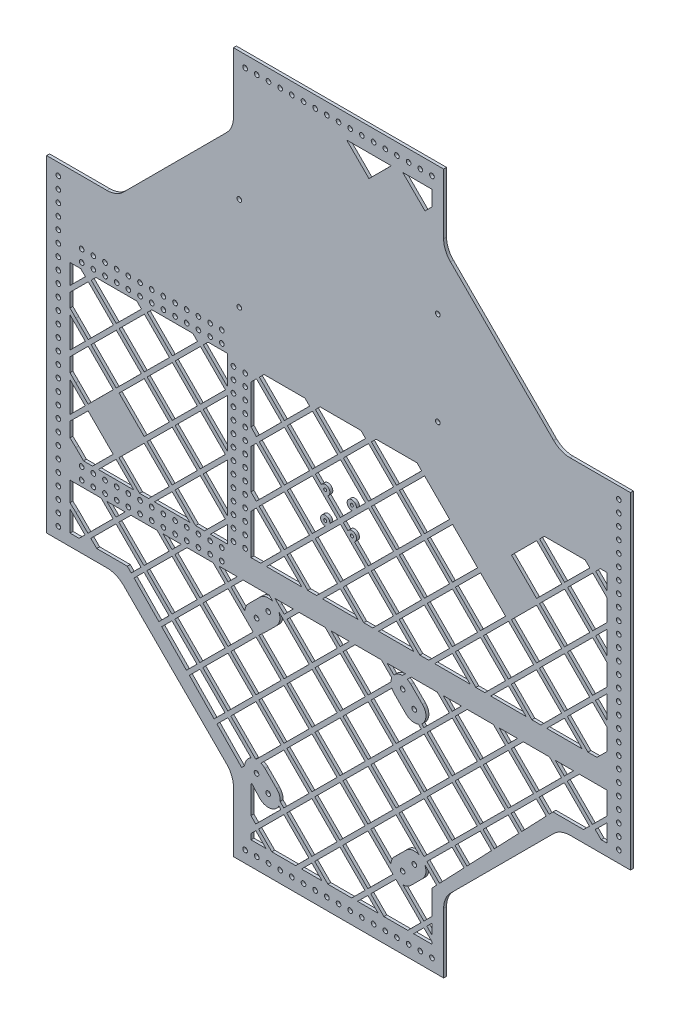
from build123d import *

# Parameters (mm, degrees)
BOSS_EXTRUDE1_DEPTH = 3.175
SKETCH2_R           = 2.54
CUT_EXTRUDE2_DEPTH  = 3.175
SKETCH3_R           = 1.651
SKETCH3_R_2         = 2.54
CUT_EXTRUDE3_DEPTH  = 3.175
SKETCH4_R           = 2.54
CUT_EXTRUDE5_DEPTH  = 3.175
SKETCH5_R           = 2.54
CUT_EXTRUDE7_DEPTH  = 3.175
FILLET1_R           = 25.4
FILLET2_R           = 25.4
FILLET3_R           = 25.4
FILLET4_R           = 25.4
FILLET5_R           = 25.4
CUT_EXTRUDE8_DEPTH  = 3.175


with BuildPart() as part:
    # Sketch1 → Boss-Extrude1 (new body)
    with BuildSketch(Plane.XY):
        Polygon((-241.3, 177.8), (-317.5, 177.8), (-317.5, -177.8), (-241.3, -177.8), (-114.3, -304.8), (-114.3, -381), (114.3, -381), (114.3, -304.8), (241.3, -177.8), (317.5, -177.8), (317.5, 177.8), (241.3, 177.8), (114.3, 304.8), (114.3, 381), (-114.3, 381), (-114.3, 304.8), align=None)
    extrude(amount=BOSS_EXTRUDE1_DEPTH)

    # Sketch2 → Cut-Extrude2 (cut)
    with BuildSketch(Plane.XY.offset(3.175)):
        with Locations((-304.8, 165.1)):
            Circle(SKETCH2_R)
        with Locations((-304.8, 152.4)):
            Circle(SKETCH2_R)
        with Locations((-304.8, 139.7)):
            Circle(SKETCH2_R)
        with Locations((-304.8, 127)):
            Circle(SKETCH2_R)
        with Locations((-304.8, 114.3)):
            Circle(SKETCH2_R)
        with Locations((-304.8, 101.6)):
            Circle(SKETCH2_R)
        with Locations((-304.8, 88.9)):
            Circle(SKETCH2_R)
        with Locations((-304.8, 76.2)):
            Circle(SKETCH2_R)
        with Locations((-304.8, 63.5)):
            Circle(SKETCH2_R)
        with Locations((-304.8, 50.8)):
            Circle(SKETCH2_R)
        with Locations((-304.8, 38.1)):
            Circle(SKETCH2_R)
        with Locations((-304.8, 25.4)):
            Circle(SKETCH2_R)
        with Locations((-304.8, 12.7)):
            Circle(SKETCH2_R)
        with Locations((-304.8, 0)):
            Circle(SKETCH2_R)
        with Locations((-304.8, -12.7)):
            Circle(SKETCH2_R)
        with Locations((-304.8, -25.4)):
            Circle(SKETCH2_R)
        with Locations((-304.8, -38.1)):
            Circle(SKETCH2_R)
        with Locations((-304.8, -50.8)):
            Circle(SKETCH2_R)
        with Locations((-304.8, -63.5)):
            Circle(SKETCH2_R)
        with Locations((-304.8, -76.2)):
            Circle(SKETCH2_R)
        with Locations((-304.8, -88.9)):
            Circle(SKETCH2_R)
        with Locations((-304.8, -101.6)):
            Circle(SKETCH2_R)
        with Locations((-304.8, -114.3)):
            Circle(SKETCH2_R)
        with Locations((-304.8, -127)):
            Circle(SKETCH2_R)
        with Locations((-304.8, -139.7)):
            Circle(SKETCH2_R)
        with Locations((-304.8, -152.4)):
            Circle(SKETCH2_R)
        with Locations((-304.8, -165.1)):
            Circle(SKETCH2_R)
        with Locations((304.8, -165.1)):
            Circle(SKETCH2_R)
        with Locations((304.8, -152.4)):
            Circle(SKETCH2_R)
        with Locations((304.8, -139.7)):
            Circle(SKETCH2_R)
        with Locations((304.8, -127)):
            Circle(SKETCH2_R)
        with Locations((304.8, -114.3)):
            Circle(SKETCH2_R)
        with Locations((304.8, -101.6)):
            Circle(SKETCH2_R)
        with Locations((304.8, -88.9)):
            Circle(SKETCH2_R)
        with Locations((304.8, -76.2)):
            Circle(SKETCH2_R)
        with Locations((304.8, -63.5)):
            Circle(SKETCH2_R)
        with Locations((304.8, -50.8)):
            Circle(SKETCH2_R)
        with Locations((304.8, -38.1)):
            Circle(SKETCH2_R)
        with Locations((304.8, -25.4)):
            Circle(SKETCH2_R)
        with Locations((304.8, -12.7)):
            Circle(SKETCH2_R)
        with Locations((304.8, 0)):
            Circle(SKETCH2_R)
        with Locations((304.8, 12.7)):
            Circle(SKETCH2_R)
        with Locations((304.8, 25.4)):
            Circle(SKETCH2_R)
        with Locations((304.8, 38.1)):
            Circle(SKETCH2_R)
        with Locations((304.8, 50.8)):
            Circle(SKETCH2_R)
        with Locations((304.8, 63.5)):
            Circle(SKETCH2_R)
        with Locations((304.8, 76.2)):
            Circle(SKETCH2_R)
        with Locations((304.8, 88.9)):
            Circle(SKETCH2_R)
        with Locations((304.8, 101.6)):
            Circle(SKETCH2_R)
        with Locations((304.8, 114.3)):
            Circle(SKETCH2_R)
        with Locations((304.8, 127)):
            Circle(SKETCH2_R)
        with Locations((304.8, 139.7)):
            Circle(SKETCH2_R)
        with Locations((304.8, 152.4)):
            Circle(SKETCH2_R)
        with Locations((304.8, 165.1)):
            Circle(SKETCH2_R)
        with Locations((-101.6, -368.3)):
            Circle(SKETCH2_R)
        with Locations((-88.9, -368.3)):
            Circle(SKETCH2_R)
        with Locations((-76.2, -368.3)):
            Circle(SKETCH2_R)
        with Locations((-63.5, -368.3)):
            Circle(SKETCH2_R)
        with Locations((-50.8, -368.3)):
            Circle(SKETCH2_R)
        with Locations((-38.1, -368.3)):
            Circle(SKETCH2_R)
        with Locations((-25.4, -368.3)):
            Circle(SKETCH2_R)
        with Locations((-12.7, -368.3)):
            Circle(SKETCH2_R)
        with Locations((0, -368.3)):
            Circle(SKETCH2_R)
        with Locations((12.7, -368.3)):
            Circle(SKETCH2_R)
        with Locations((25.4, -368.3)):
            Circle(SKETCH2_R)
        with Locations((38.1, -368.3)):
            Circle(SKETCH2_R)
        with Locations((50.8, -368.3)):
            Circle(SKETCH2_R)
        with Locations((63.5, -368.3)):
            Circle(SKETCH2_R)
        with Locations((76.2, -368.3)):
            Circle(SKETCH2_R)
        with Locations((88.9, -368.3)):
            Circle(SKETCH2_R)
        with Locations((101.6, -368.3)):
            Circle(SKETCH2_R)
        with Locations((101.6, 368.3)):
            Circle(SKETCH2_R)
        with Locations((88.9, 368.3)):
            Circle(SKETCH2_R)
        with Locations((76.2, 368.3)):
            Circle(SKETCH2_R)
        with Locations((63.5, 368.3)):
            Circle(SKETCH2_R)
        with Locations((50.8, 368.3)):
            Circle(SKETCH2_R)
        with Locations((38.1, 368.3)):
            Circle(SKETCH2_R)
        with Locations((25.4, 368.3)):
            Circle(SKETCH2_R)
        with Locations((12.7, 368.3)):
            Circle(SKETCH2_R)
        with Locations((0, 368.3)):
            Circle(SKETCH2_R)
        with Locations((-12.7, 368.3)):
            Circle(SKETCH2_R)
        with Locations((-25.4, 368.3)):
            Circle(SKETCH2_R)
        with Locations((-38.1, 368.3)):
            Circle(SKETCH2_R)
        with Locations((-50.8, 368.3)):
            Circle(SKETCH2_R)
        with Locations((-63.5, 368.3)):
            Circle(SKETCH2_R)
        with Locations((-76.2, 368.3)):
            Circle(SKETCH2_R)
        with Locations((-88.9, 368.3)):
            Circle(SKETCH2_R)
        with Locations((-101.6, 368.3)):
            Circle(SKETCH2_R)
    extrude(amount=-CUT_EXTRUDE2_DEPTH, mode=Mode.SUBTRACT)

    # Sketch3 → Cut-Extrude3 (cut)
    with BuildSketch(Plane.XY.offset(3.175)):
        with Locations((-14.478, 14.478)):
            Circle(SKETCH3_R)
        with Locations((14.478, 14.478)):
            Circle(SKETCH3_R)
        with Locations((-14.478, -14.478)):
            Circle(SKETCH3_R)
        with Locations((14.478, -14.478)):
            Circle(SKETCH3_R)
        with Locations((-107.95, 241.3)):
            Circle(SKETCH3_R_2)
        with Locations((107.95, 241.3)):
            Circle(SKETCH3_R_2)
        with Locations((-107.95, 139.7)):
            Circle(SKETCH3_R_2)
        with Locations((107.95, 139.7)):
            Circle(SKETCH3_R_2)
    extrude(amount=-CUT_EXTRUDE3_DEPTH, mode=Mode.SUBTRACT)

    # Sketch4 → Cut-Extrude5 (cut)
    with BuildSketch(Plane.XY.offset(3.175)):
        with Locations((-114.3, -84.201)):
            Circle(SKETCH4_R)
        with Locations((-114.3, 80.899)):
            Circle(SKETCH4_R)
        with Locations((-279.4, 96.139)):
            Circle(SKETCH4_R)
        with Locations((-266.7, 96.139)):
            Circle(SKETCH4_R)
        with Locations((-254, 96.139)):
            Circle(SKETCH4_R)
        with Locations((-241.3, 96.139)):
            Circle(SKETCH4_R)
        with Locations((-228.6, 96.139)):
            Circle(SKETCH4_R)
        with Locations((-215.9, 96.139)):
            Circle(SKETCH4_R)
        with Locations((-203.2, 96.139)):
            Circle(SKETCH4_R)
        with Locations((-190.5, 96.139)):
            Circle(SKETCH4_R)
        with Locations((-177.8, 96.139)):
            Circle(SKETCH4_R)
        with Locations((-165.1, 96.139)):
            Circle(SKETCH4_R)
        with Locations((-152.4, 96.139)):
            Circle(SKETCH4_R)
        with Locations((-139.7, 96.139)):
            Circle(SKETCH4_R)
        with Locations((-127, 96.139)):
            Circle(SKETCH4_R)
        with Locations((-127, -96.139)):
            Circle(SKETCH4_R)
        with Locations((-139.7, -96.139)):
            Circle(SKETCH4_R)
        with Locations((-152.4, -96.139)):
            Circle(SKETCH4_R)
        with Locations((-165.1, -96.139)):
            Circle(SKETCH4_R)
        with Locations((-177.8, -96.139)):
            Circle(SKETCH4_R)
        with Locations((-190.5, -96.139)):
            Circle(SKETCH4_R)
        with Locations((-203.2, -96.139)):
            Circle(SKETCH4_R)
        with Locations((-215.9, -96.139)):
            Circle(SKETCH4_R)
        with Locations((-228.6, -96.139)):
            Circle(SKETCH4_R)
        with Locations((-241.3, -96.139)):
            Circle(SKETCH4_R)
        with Locations((-254, -96.139)):
            Circle(SKETCH4_R)
        with Locations((-266.7, -96.139)):
            Circle(SKETCH4_R)
        with Locations((-279.4, -96.139)):
            Circle(SKETCH4_R)
        with Locations((-279.4, -108.839)):
            Circle(SKETCH4_R)
        with Locations((-279.4, 108.839)):
            Circle(SKETCH4_R)
        with Locations((-266.7, 108.839)):
            Circle(SKETCH4_R)
        with Locations((-254, 108.839)):
            Circle(SKETCH4_R)
        with Locations((-241.3, 108.839)):
            Circle(SKETCH4_R)
        with Locations((-228.6, 108.839)):
            Circle(SKETCH4_R)
        with Locations((-215.9, 108.839)):
            Circle(SKETCH4_R)
        with Locations((-203.2, 108.839)):
            Circle(SKETCH4_R)
        with Locations((-190.5, 108.839)):
            Circle(SKETCH4_R)
        with Locations((-177.8, 108.839)):
            Circle(SKETCH4_R)
        with Locations((-165.1, 108.839)):
            Circle(SKETCH4_R)
        with Locations((-152.4, 108.839)):
            Circle(SKETCH4_R)
        with Locations((-139.7, 108.839)):
            Circle(SKETCH4_R)
        with Locations((-127, 108.839)):
            Circle(SKETCH4_R)
        with Locations((-127, -108.839)):
            Circle(SKETCH4_R)
        with Locations((-139.7, -108.839)):
            Circle(SKETCH4_R)
        with Locations((-152.4, -108.839)):
            Circle(SKETCH4_R)
        with Locations((-165.1, -108.839)):
            Circle(SKETCH4_R)
        with Locations((-177.8, -108.839)):
            Circle(SKETCH4_R)
        with Locations((-190.5, -108.839)):
            Circle(SKETCH4_R)
        with Locations((-203.2, -108.839)):
            Circle(SKETCH4_R)
        with Locations((-215.9, -108.839)):
            Circle(SKETCH4_R)
        with Locations((-228.6, -108.839)):
            Circle(SKETCH4_R)
        with Locations((-241.3, -108.839)):
            Circle(SKETCH4_R)
        with Locations((-254, -108.839)):
            Circle(SKETCH4_R)
        with Locations((-266.7, -108.839)):
            Circle(SKETCH4_R)
        with Locations((-114.3, 68.199)):
            Circle(SKETCH4_R)
        with Locations((-101.6, -84.201)):
            Circle(SKETCH4_R)
        with Locations((-101.6, -71.501)):
            Circle(SKETCH4_R)
        with Locations((-101.6, -58.801)):
            Circle(SKETCH4_R)
        with Locations((-101.6, -46.101)):
            Circle(SKETCH4_R)
        with Locations((-101.6, -33.401)):
            Circle(SKETCH4_R)
        with Locations((-101.6, -20.701)):
            Circle(SKETCH4_R)
        with Locations((-101.6, -8.001)):
            Circle(SKETCH4_R)
        with Locations((-101.6, 4.699)):
            Circle(SKETCH4_R)
        with Locations((-101.6, 17.399)):
            Circle(SKETCH4_R)
        with Locations((-101.6, 30.099)):
            Circle(SKETCH4_R)
        with Locations((-101.6, 42.799)):
            Circle(SKETCH4_R)
        with Locations((-101.6, 55.499)):
            Circle(SKETCH4_R)
        with Locations((-101.6, 68.199)):
            Circle(SKETCH4_R)
        with Locations((-101.6, 80.899)):
            Circle(SKETCH4_R)
        with Locations((-114.3, 55.499)):
            Circle(SKETCH4_R)
        with Locations((-114.3, 42.799)):
            Circle(SKETCH4_R)
        with Locations((-114.3, 30.099)):
            Circle(SKETCH4_R)
        with Locations((-114.3, 17.399)):
            Circle(SKETCH4_R)
        with Locations((-114.3, 4.699)):
            Circle(SKETCH4_R)
        with Locations((-114.3, -8.001)):
            Circle(SKETCH4_R)
        with Locations((-114.3, -20.701)):
            Circle(SKETCH4_R)
        with Locations((-114.3, -33.401)):
            Circle(SKETCH4_R)
        with Locations((-114.3, -46.101)):
            Circle(SKETCH4_R)
        with Locations((-114.3, -58.801)):
            Circle(SKETCH4_R)
        with Locations((-114.3, -71.501)):
            Circle(SKETCH4_R)
    extrude(amount=-CUT_EXTRUDE5_DEPTH, mode=Mode.SUBTRACT)

    # Sketch5 → Cut-Extrude7 (cut)
    with BuildSketch(Plane.XY.offset(3.175)):
        with Locations((-76.492754683, -131.119022234)):
            Circle(SKETCH5_R)
        with Locations((-89.192754683, -143.819022234)):
            Circle(SKETCH5_R)
        with Locations((69.658845317, -131.119022234)):
            Circle(SKETCH5_R)
        with Locations((82.358845317, -143.819022234)):
            Circle(SKETCH5_R)
        with Locations((82.358845317, -289.970622234)):
            Circle(SKETCH5_R)
        with Locations((69.658845317, -302.670622234)):
            Circle(SKETCH5_R)
        with Locations((-76.492754683, -302.670622234)):
            Circle(SKETCH5_R)
        with Locations((-89.192754683, -289.970622234)):
            Circle(SKETCH5_R)
    extrude(amount=-CUT_EXTRUDE7_DEPTH, mode=Mode.SUBTRACT)

    # Fillet1
    fillet1_edges = [part.edges().sort_by_distance(p)[0] for p in [
        (-241.3, -177.8, 1.5875),
    ]]
    fillet(fillet1_edges, radius=FILLET1_R)

    # Fillet2
    fillet2_edges = [part.edges().sort_by_distance(p)[0] for p in [
        (-114.3, -304.8, 1.5875),
    ]]
    fillet(fillet2_edges, radius=FILLET2_R)

    # Fillet3
    fillet3_edges = [part.edges().sort_by_distance(p)[0] for p in [
        (114.3, -304.8, 1.5875),
        (241.3, -177.8, 1.5875),
    ]]
    fillet(fillet3_edges, radius=FILLET3_R)

    # Fillet4
    fillet4_edges = [part.edges().sort_by_distance(p)[0] for p in [
        (114.3, 304.8, 1.5875),
        (241.3, 177.8, 1.5875),
    ]]
    fillet(fillet4_edges, radius=FILLET4_R)

    # Fillet5
    fillet5_edges = [part.edges().sort_by_distance(p)[0] for p in [
        (-241.3, 177.8, 1.5875),
        (-114.3, 304.8, 1.5875),
    ]]
    fillet(fillet5_edges, radius=FILLET5_R)

    # Sketch7 → Cut-Extrude8 (cut)
    with BuildSketch(Plane.XY.offset(3.175)):
        with BuildLine():
            Line((-98.184821722, -134.845737084), (-85.494687088, -122.129040862))
            ThreePointArc((-85.494687088, -122.129040862), (-78.628005541, -118.574432494), (-70.971329287, -119.652330847))
            Line((-70.971329287, -119.652330847), (-75.433951777, -115.189))
            Line((-75.433951777, -115.189), (-103.85276116, -115.189))
            Line((-103.85276116, -115.189), (-116.971631728, -128.263395034))
            Line((-116.971631728, -128.263395034), (-101.887519046, -143.349902012))
            ThreePointArc((-101.887519046, -143.349902012), (-100.840066362, -138.74780476), (-98.184821722, -134.845737084))
        make_face()
        with BuildLine():
            Line((-67.502773296, -140.120954724), (-80.219469568, -152.811089309))
            ThreePointArc((-80.219469568, -152.811089309), (-81.258690332, -153.740097726), (-82.393439983, -154.549652954))
            Line((-82.393439983, -154.549652954), (-84.284463929, -156.440376783))
            Line((-84.284463929, -156.440376783), (-86.545804888, -158.694051356))
            Line((-86.545804888, -158.694051356), (-59.289334923, -185.954847732))
            Line((-59.289334923, -185.954847732), (-31.935804859, -158.694051424))
            Line((-31.935804859, -158.694051424), (-57.56647343, -133.05931447))
            Line((-57.56647343, -133.05931447), (-65.025187583, -125.599416388))
            ThreePointArc((-65.025187583, -125.599416388), (-63.948334661, -133.255268416), (-67.502773296, -140.120954724))
        make_face()
        with BuildLine():
            Line((60.280451027, -294.0920176), (72.643928389, -281.827084389))
            ThreePointArc((72.643928389, -281.827084389), (79.73308493, -277.56892066), (87.939692092, -278.588576336))
            Line((87.939692092, -278.588576336), (62.511032708, -253.155880635))
            Line((62.511032708, -253.155880635), (35.157502709, -280.416676879))
            Line((35.157502709, -280.416676879), (56.925364075, -302.18799345))
            ThreePointArc((56.925364075, -302.18799345), (57.88280902, -297.841586504), (60.280451027, -294.0920176))
        make_face()
        with BuildLine():
            Line((91.249518726, -299.006813129), (78.353512395, -311.934871675))
            ThreePointArc((78.353512395, -311.934871675), (74.559126798, -314.412673024), (70.136500565, -315.401226906))
            Line((70.136500565, -315.401226906), (92.839799146, -338.108129491))
            Line((92.839799146, -338.108129491), (101.599999978, -329.377627211))
            Line((101.599999978, -329.377627211), (101.599999978, -302.705897911))
            Line((101.599999978, -302.705897911), (106.710118143, -297.361981836))
            Line((106.710118143, -297.361981836), (93.741776855, -284.39158207))
            ThreePointArc((93.741776855, -284.39158207), (94.855085116, -292.10153998), (91.249518726, -299.006813129))
        make_face()
        with BuildLine():
            ThreePointArc((-84.283511312, -277.949331359), (-82.007220036, -279.154883858), (-80.013678376, -280.786033896))
            Line((-80.013678376, -280.786033896), (-67.309867493, -293.482220725))
            ThreePointArc((-67.309867493, -293.482220725), (-64.31386037, -298.151034561), (-63.538813818, -303.644046863))
            Line((-63.538813818, -303.644046863), (-59.506027488, -307.677473321))
            Line((-59.506027488, -307.677473321), (-32.152497389, -280.416676976))
            Line((-32.152497389, -280.416676976), (-59.408967431, -253.155880488))
            Line((-59.408967431, -253.155880488), (-83.328830746, -276.994650793))
            Line((-83.328830746, -276.994650793), (-84.283511312, -277.949331359))
        make_face()
        with BuildLine():
            Line((-85.782728065, -311.750739744), (-94.284212526, -302.103134487))
            Line((-94.284212526, -302.103134487), (-95.249999849, -302.954187749))
            Line((-95.249999849, -302.954187749), (-95.249999849, -332.897503271))
            Line((-95.249999849, -332.897503271), (-90.040200527, -338.108129611))
            Line((-90.040200527, -338.108129611), (-62.686670523, -310.847333362))
            Line((-62.686670523, -310.847333362), (-64.934171741, -308.599475396))
            ThreePointArc((-64.934171741, -308.599475396), (-74.551295417, -315.515188219), (-85.782728065, -311.750739744))
        make_face()
        Polygon((101.6, 338.909043196), (101.6, 355.599999928), (69.801765259, 355.599999928), (94.031608819, 331.366310339), align=None)
        Polygon((92.948145642, -277.246816941), (120.301675746, -249.986020592), (93.045205846, -222.725224245), (65.691675743, -249.986020594), align=None)
        Polygon((229.017369551, -169.458934272), (233.185599159, -165.1), (266.4364552, -165.1), (272.864195328, -158.694051166), (245.607725452, -131.433254887), (218.254195156, -158.694051428), align=None)
        Polygon((81.638426288, -355.60000025), (101.599999978, -355.60000025), (101.599999978, -353.220728772), (92.828513161, -344.447849649), align=None)
        Polygon((-263.020872944, -165.1), (-229.689487758, -165.1), (-225.526643889, -169.368578147), (-214.815805085, -158.694051194), (-242.07227485, -131.433254983), (-269.42580499, -158.694051294), align=None)
        Polygon((-86.65415113, -219.555364193), (-59.397681355, -246.816160414), (-32.044151227, -219.555364097), (-59.300621029, -192.294567848), align=None)
        with BuildLine():
            ThreePointArc((74.727379067, -119.474282408), (76.808460175, -120.622689189), (78.639101444, -122.138766119))
            Line((78.639101444, -122.138766119), (91.339101436, -134.838766127))
            ThreePointArc((91.339101436, -134.838766127), (95.048045081, -144.342671996), (90.568643955, -153.508666502))
            Line((90.568643955, -153.508666502), (92.870089445, -155.817940878))
            Line((92.870089445, -155.817940878), (120.518368288, -128.263395045))
            Line((120.518368288, -128.263395045), (107.446048225, -115.189))
            Line((107.446048225, -115.189), (79.02723884, -115.189))
            Line((79.02723884, -115.189), (75.784235839, -118.421008587))
            Line((75.784235839, -118.421008587), (74.727379067, -119.474282408))
        make_face()
        Polygon((-258.313951776, -115.189), (-292.100000028, -115.189), (-292.100000028, -136.524575346), (-285.750000002, -142.367265128), (-272.595161951, -155.524191258), (-245.24163181, -128.263394947), align=None)
        with BuildLine():
            Line((73.37858921, -152.799278353), (60.678589202, -140.099278361))
            ThreePointArc((60.678589202, -140.099278361), (59.150387547, -138.25080429), (57.99696019, -136.147981896))
            Line((57.99696019, -136.147981896), (35.374195107, -158.694051387))
            Line((35.374195107, -158.694051387), (62.630665052, -185.954847778))
            Line((62.630665052, -185.954847778), (89.984195141, -158.694051443))
            Line((89.984195141, -158.694051443), (86.950527943, -155.659902707))
            ThreePointArc((86.950527943, -155.659902707), (79.739553958, -156.245981335), (73.37858921, -152.799278353))
        make_face()
        Polygon((-120.65, 58.324585843), (-120.65, 89.789000011), (-142.017481788, 89.789000011), (-147.072419558, 84.751199466), align=None)
        Polygon((-89.293062601, 81.581339414), (-95.250000009, 75.64459719), (-95.250000009, 33.438695612), (-89.338546527, 27.111148313), (-62.036592749, 54.320543116), align=None)
        Polygon((-95.249999755, -355.60000025), (-78.901106158, -355.60000025), (-90.051486631, -344.447849733), (-95.249999755, -349.628738892), align=None)
        Polygon((169.415866311, -231.787322949), (196.112372979, -203.869398845), (184.539378983, -192.294567857), (157.185848866, -219.55536422), align=None)
        Polygon((-95.250000009, -27.896529968), (-89.471550028, -33.77473783), (-62.14493914, -6.540769531), (-89.427628342, 20.746250283), (-95.250000009, 15.038671504), align=None)
        Polygon((139.615114716, -262.951517262), (166.311621352, -235.033593192), (154.005205831, -222.72522426), (126.651675745, -249.986020592), align=None)
        Polygon((292.1, -78.770125863), (292.1, -55.993557114), (276.250244659, -40.141285925), (248.897059238, -67.401738761), (271.280851834, -89.788999974), (281.043642701, -89.788999974), align=None)
        Polygon((-11.591106142, -355.60000025), (14.328426288, -355.60000025), (28.699156341, -341.277989749), (1.442686442, -314.017193403), (-25.910843658, -341.277989748), align=None)
        Polygon((-72.551106158, -355.60000025), (-46.631573711, -355.60000025), (-32.260843658, -341.277989748), (-59.517313555, -314.017193405), (-86.870843577, -341.277989674), align=None)
        Polygon((292.1, 42.736541774), (292.1, 65.949607141), (276.468846375, 81.583241915), (249.113407278, 54.320543101), (276.369876999, 27.059746931), align=None)
        Polygon((20.678426288, -355.60000025), (43.018893856, -355.60000025), (31.868513306, -344.447849789), align=None)
        Polygon((49.368893855, -355.60000025), (75.288426288, -355.60000025), (89.659156156, -341.277989568), (62.402686439, -314.017193405), (35.049156341, -341.277989749), align=None)
        Polygon((-292.100000028, -20.427912614), (-292.100000028, -53.456236922), (-275.55911223, -36.971425964), align=None)
        Polygon((-292.100000028, 89.789), (-292.100000028, 68.05043048), (-275.342419563, 84.751199464), (-280.379420571, 89.789), align=None)
        Polygon((-292.100000028, 40.541763629), (-292.100000028, 7.283376379), (-275.443894595, 23.883014356), align=None)
        Polygon((-275.77580499, -158.694051294), (-292.100000028, -142.367265102), (-292.100000028, -165.1), (-282.203544995, -165.1), align=None)
        Polygon((-216.399920675, -89.788999974), (-206.636357388, -89.788999974), (-184.173285456, -67.402082259), (-211.429755292, -40.141285975), (-238.783285428, -67.402082287), align=None)
        Polygon((-261.246357326, -89.788999974), (-222.749920675, -89.788999974), (-241.963928467, -70.571942324), align=None)
        Polygon((-155.439920675, -89.788999974), (-145.67635753, -89.788999974), (-123.213285518, -67.402082196), (-150.469755317, -40.141285949), (-177.823285456, -67.402082259), align=None)
        Polygon((-200.286357388, -89.788999974), (-161.789920675, -89.788999974), (-181.003928495, -70.571942295), align=None)
        Polygon((-95.250000009, -89.788999974), (-84.716357245, -89.788999974), (-62.253285391, -67.402082321), (-89.467154955, -40.183893072), (-95.250000009, -46.103888993), align=None)
        Polygon((-33.519920673, -89.788999974), (-23.756357298, -89.788999974), (-1.293285427, -67.402082296), (-28.549755266, -40.141286007), (-55.903285391, -67.402082321), align=None)
        Polygon((-78.366357246, -89.788999974), (-39.869920673, -89.788999974), (-59.08392843, -70.571942358), align=None)
        Polygon((27.440079314, -89.788999974), (37.203642687, -89.788999974), (59.666714551, -67.402082267), (32.410244699, -40.141285969), (5.056714573, -67.402082296), align=None)
        Polygon((-17.406357299, -89.788999974), (21.090079314, -89.788999974), (1.876071535, -70.571942334), align=None)
        Polygon((88.400079325, -89.788999974), (98.163642754, -89.788999974), (120.626714613, -67.402082316), (93.370244659, -40.141285915), (66.016714551, -67.402082267), align=None)
        Polygon((43.553642687, -89.788999974), (82.050079325, -89.788999974), (62.836071516, -70.571942307), align=None)
        Polygon((149.360079336, -89.788999974), (159.123642702, -89.788999974), (181.586714707, -67.402082123), (154.330244866, -40.141285875), (126.976714613, -67.402082316), align=None)
        Polygon((104.513642754, -89.788999974), (143.010079336, -89.788999974), (123.796071575, -70.571942353), align=None)
        Polygon((210.320079657, -89.788999974), (220.083642702, -89.788999974), (242.547059238, -67.401738761), (215.290537876, -40.140993701), (187.936714707, -67.402082123), align=None)
        Polygon((199.216617939, -200.623128603), (225.913124591, -172.705204515), (215.073552121, -161.863911468), (187.720022018, -189.124707817), align=None)
        Polygon((165.473642701, -89.788999974), (203.970079657, -89.788999974), (184.756071675, -70.571942161), align=None)
        Polygon((226.433642701, -89.788999974), (264.930851834, -89.788999974), (245.716422187, -70.571592838), align=None)
        Polygon((-150.458469238, -33.801565878), (-123.104939099, -6.540769569), (-150.361408944, 20.720026723), (-177.714939079, -6.54076959), align=None)
        Polygon((109.814363103, -294.115711594), (136.510869757, -266.197787505), (123.471032711, -253.155880632), (96.117502607, -280.416676981), align=None)
        Polygon((292.1, -18.016792047), (292.1, 4.976119129), (276.35859093, 20.72002685), (249.005060829, -6.540769497), (276.261530729, -33.801565845), align=None)
        Polygon((-150.350122863, 27.059746797), (-122.996592728, 54.320543109), (-150.253062597, 81.581339429), (-177.606592725, 54.32054311), align=None)
        Polygon((-40.281573712, -355.60000025), (-17.941106142, -355.60000025), (-29.091486693, -344.447849788), align=None)
        with BuildLine():
            ThreePointArc((-90.157218448, -277.021417068), (-89.918148063, -277.00582724), (-89.678830745, -276.994650793))
            Line((-89.678830745, -276.994650793), (-62.578324393, -249.986020451))
            Line((-62.578324393, -249.986020451), (-89.834794165, -222.725224233))
            Line((-89.834794165, -222.725224233), (-117.188324265, -249.986020577))
            Line((-117.188324265, -249.986020577), (-90.157218448, -277.021417068))
        make_face()
        with BuildLine():
            ThreePointArc((-102.167000616, -289.440483327), (-100.131563165, -282.973867716), (-95.114435966, -278.414420628))
            Line((-95.114435966, -278.414420628), (-120.3689673, -253.155880617))
            Line((-120.3689673, -253.155880617), (-132.258788612, -265.005393136))
            Line((-132.258788612, -265.005393136), (-105.342562093, -292.605279164))
            Line((-105.342562093, -292.605279164), (-102.167000616, -289.440483327))
        make_face()
        Polygon((-162.304809134, -234.196217806), (-135.388582405, -261.796104051), (-123.538324265, -249.986020577), (-150.794794265, -222.725224131), align=None)
        Polygon((-192.350829518, -203.387042619), (-165.434602925, -230.986928724), (-153.964151227, -219.555364094), (-181.220621097, -192.294567778), align=None)
        Polygon((-222.396850102, -172.577867227), (-195.480623308, -200.177753537), (-184.389978059, -189.124707741), (-211.646448125, -161.863911229), align=None)
        Polygon((-277.359920675, -89.788999974), (-267.596357326, -89.788999974), (-245.133285428, -67.402082287), (-272.389755268, -40.141286001), (-285.749999994, -53.456236887), (-292.100000028, -59.518217807), (-292.100000028, -75.505421203), (-285.750000028, -81.397588858), align=None)
        with BuildLine():
            ThreePointArc((-14.240895343, -19.552463655), (-18.063997976, -10.879803435), (-9.4043708, -14.732335874))
            Line((-9.4043708, -14.732335874), (-1.18493906, -6.540769614))
            Line((-1.18493906, -6.540769614), (-28.441408994, 20.720026765))
            Line((-28.441408994, 20.720026765), (-55.79493914, -6.540769531))
            Line((-55.79493914, -6.540769531), (-28.538469189, -33.801565932))
            Line((-28.538469189, -33.801565932), (-14.240895343, -19.552463655))
        make_face()
        with BuildLine():
            ThreePointArc((14.81958641, 9.409497388), (10.892002024, 18.076196565), (19.545313378, 14.119203219))
            Line((19.545313378, 14.119203219), (29.349234115, 23.88988675))
            Line((29.349234115, 23.88988675), (2.092764205, 51.150683107))
            Line((2.092764205, 51.150683107), (-25.260765953, 23.8898868))
            Line((-25.260765953, 23.8898868), (-18.689958436, 17.318036292))
            ThreePointArc((-18.689958436, 17.318036292), (-10.885612496, 18.069817372), (-11.638632259, 10.265590851))
            Line((-11.638632259, 10.265590851), (1.995703978, -3.370909577))
            Line((1.995703978, -3.370909577), (14.81958641, 9.409497388))
        make_face()
        with BuildLine():
            ThreePointArc((56.961667651, -130.851292333), (57.201134254, -128.650128742), (57.8192573, -126.524008024))
            Line((57.8192573, -126.524008024), (46.486048209, -115.189))
            Line((46.486048209, -115.189), (18.067238824, -115.189))
            Line((18.067238824, -115.189), (4.948368279, -128.263395036))
            Line((4.948368279, -128.263395036), (32.204838145, -155.52419135))
            Line((32.204838145, -155.52419135), (56.961667651, -130.851292333))
        make_face()
        with BuildLine():
            ThreePointArc((60.242744495, -122.596871959), (64.405724102, -119.556379046), (69.434235839, -118.421008587))
            Line((69.434235839, -118.421008587), (72.67723884, -115.189))
            Line((72.67723884, -115.189), (52.836048209, -115.189))
            Line((52.836048209, -115.189), (60.242744495, -122.596871959))
        make_face()
        Polygon((1.984417902, -9.710629651), (-25.369112228, -36.971425969), (1.887357611, -64.232222258), (29.240887737, -36.971425932), align=None)
        Polygon((174.756048234, -115.189), (184.659011327, -125.093535001), (194.59723884, -115.189), align=None)
        Polygon((35.26584888, -219.555364209), (62.522318778, -246.816160554), (89.875848881, -219.555364205), (62.619378983, -192.294567859), align=None)
        Polygon((-58.975582181, -9.710629566), (-86.329112328, -36.971425862), (-59.072642353, -64.232222284), (-31.719112228, -36.971425969), align=None)
        Polygon((279.430887694, -36.971425885), (292.1, -49.642549172), (292.1, -24.345264319), align=None)
        Polygon((279.649489413, 84.753101952), (292.101905884, 72.298708896), (292.1, 89.789), (284.702518216, 89.789), align=None)
        Polygon((-272.173062603, 81.581339428), (-292.100000028, 61.721958224), (-292.100000028, 46.891763629), (-285.750000006, 40.541763607), (-272.263251556, 27.052874392), (-244.909721421, 54.313670708), align=None)
        Polygon((-272.274537634, 20.713154319), (-292.100000028, 0.954904121), (-292.100000028, -14.077912614), (-285.750000002, -20.427912641), (-272.378469192, -33.801565927), (-245.024939063, -6.540769607), align=None)
        Polygon((-120.65, -71.175958971), (-139.32635753, -89.788999974), (-120.65, -89.788999974), align=None)
        Polygon((-147.289112277, -36.971425914), (-120.65, -63.614766645), (-120.65, -10.422625449), align=None)
        Polygon((279.214195343, -158.694051379), (285.619127283, -165.1), (292.1, -165.1), (292.1, -145.85193189), align=None)
        with BuildLine():
            Line((5.16506094, -6.540769614), (10.264191435, -11.640709499))
            ThreePointArc((10.264191435, -11.640709499), (18.070387504, -10.886182629), (17.314621656, -18.692258842))
            Line((17.314621656, -18.692258842), (32.421530775, -33.801565895))
            Line((32.421530775, -33.801565895), (59.775060906, -6.540769564))
            Line((59.775060906, -6.540769564), (32.518591077, 20.720026713))
            Line((32.518591077, 20.720026713), (5.16506094, -6.540769614))
        make_face()
        Polygon((-58.855949709, 57.490403151), (-31.50241956, 84.751199471), (-36.539420572, 89.789000011), (-81.057481772, 89.789000011), (-86.112419562, 84.75119945), align=None)
        Polygon((279.539233964, 23.889886891), (292.1, 11.327127071), (292.1, 36.408069502), align=None)
        Polygon((-58.867235788, 51.15068308), (-86.220765921, 23.889886776), (-58.964296099, -3.370909496), (-31.610765953, 23.8898868), align=None)
        Polygon((-42.89276116, -115.189), (-56.011631727, -128.263395033), (-28.755161824, -155.524191384), (-1.401631721, -128.263395036), (-14.473951774, -115.189), align=None)
        Polygon((-69.083951777, -115.189), (-64.621329287, -119.652330847), (-59.020233049, -124.933324349), (-49.24276116, -115.189), align=None)
        Polygon((101.599999978, -335.706099645), (96.009156152, -341.277989572), (101.599999978, -346.86972083), align=None)
        Polygon((4.623329476, -310.847333363), (31.879799376, -338.108129709), (59.233329474, -310.847333365), (31.976859575, -283.586537019), align=None)
        Polygon((4.731675826, -249.986020515), (31.988145742, -277.246816841), (59.341675743, -249.986020594), (32.085205845, -222.725224249), align=None)
        Polygon((1.453972511, -307.677473323), (28.80750261, -280.416676979), (1.551032712, -253.155880634), (-25.802497386, -280.416676979), align=None)
        Polygon((-29.080200623, -338.108129708), (-1.726670523, -310.847333363), (-28.983140421, -283.586537019), (-56.33667052, -310.847333365), align=None)
        Polygon((96.225848881, -219.555364205), (123.482318781, -246.816160551), (150.835848866, -219.55536422), (123.579378969, -192.294567872), align=None)
        Polygon((126.760022004, -189.124707831), (154.016491901, -216.385504179), (181.370022018, -189.124707817), (154.113552118, -161.863911471), align=None)
        Polygon((157.294195153, -158.694051431), (184.550665053, -185.954847777), (211.904195156, -158.694051428), (184.647725257, -131.433255081), align=None)
        Polygon((187.828368292, -128.263395041), (215.084838191, -155.524191387), (242.438368484, -128.263394849), (229.366048597, -115.189), (200.94723884, -115.189), align=None)
        Polygon((248.788368454, -128.263394879), (276.044838272, -155.524191224), (292.1, -139.52345963), (292.1, -115.189), (261.90723884, -115.189), align=None)
        Polygon((5.273407246, 54.320543142), (32.529877154, 27.059746787), (59.883407335, 54.320543157), (32.626937427, 81.581339473), align=None)
        Polygon((235.716048597, -115.189), (245.619011494, -125.093534834), (255.55723884, -115.189), align=None)
        Polygon((154.124838188, -155.524191391), (181.478368292, -128.263395041), (168.406048234, -115.189), (139.98723884, -115.189), (126.868368288, -128.263395045), align=None)
        Polygon((123.590665039, -185.954847791), (150.944195153, -158.694051431), (123.687725253, -131.433255085), (96.334195142, -158.694051443), align=None)
        Polygon((93.056491916, -216.385504165), (120.410022004, -189.124707831), (93.153552107, -161.863911484), (65.800022018, -189.124707819), align=None)
        Polygon((-56.228324393, -249.986020451), (-28.971854354, -277.246816936), (-1.618324255, -249.986020592), (-28.874794266, -222.725224134), align=None)
        Polygon((-25.694151168, -219.555364038), (1.562318857, -246.816160474), (28.915848879, -219.555364207), (1.6593789, -192.294567781), align=None)
        Polygon((4.840021938, -189.124707744), (32.096491914, -216.385504167), (59.450022017, -189.124707818), (32.193552069, -161.863911423), align=None)
        Polygon((113.796048225, -115.189), (123.699011323, -125.093535005), (133.63723884, -115.189), align=None)
        Polygon((1.670664976, -185.954847707), (29.024195107, -158.694051387), (1.767725244, -131.433255077), (-25.585804859, -158.694051424), align=None)
        Polygon((-28.863508132, -216.385504004), (-1.509978062, -189.124707744), (-28.766447894, -161.863911464), (-56.119977956, -189.12470777), align=None)
        Polygon((-238.891631811, -128.263394947), (-211.635162044, -155.52419116), (-184.281631896, -128.263394862), (-197.353951776, -115.189), (-225.77276132, -115.189), align=None)
        Polygon((-181.112274937, -131.433254896), (-208.465805085, -158.694051194), (-181.209335021, -185.954847704), (-153.855804893, -158.694051387), align=None)
        Polygon((-191.003951776, -115.189), (-181.100988856, -125.093534827), (-171.162761482, -115.189), align=None)
        Polygon((-164.812761482, -115.189), (-177.931631896, -128.263394862), (-150.675161854, -155.52419135), (-123.321631726, -128.263395032), (-136.393951776, -115.189), align=None)
        Polygon((-251.963951776, -115.189), (-242.060988771, -125.093534912), (-232.12276132, -115.189), align=None)
        Polygon((-241.74036446, 51.143810672), (-269.093894595, 23.883014356), (-241.844296025, -3.37090957), (-214.490765895, 23.88988675), align=None)
        Polygon((-263.937481787, 89.789000011), (-268.992419564, 84.751199464), (-241.729078383, 57.483530745), (-214.37554825, 84.744327058), (-219.419420584, 89.789000011), align=None)
        Polygon((-211.321408934, 20.720026713), (-238.674939063, -6.540769607), (-211.418469215, -33.801565903), (-184.064939079, -6.54076959), align=None)
        Polygon((-238.559721422, 54.313670708), (-211.310122857, 27.059746787), (-183.956592729, 54.320543106), (-211.206191289, 81.574467022), align=None)
        Polygon((-180.787235768, 51.150683069), (-208.140765896, 23.88988675), (-180.88429604, -3.370909553), (-153.530765905, 23.889886759), align=None)
        Polygon((-208.025548239, 84.74432707), (-180.775949691, 57.490403144), (-153.422419559, 84.751199466), (-158.459420575, 89.789000011), (-202.963714692, 89.789000011), align=None)
        Polygon((-20.09748179, 89.789000011), (-25.15241956, 84.751199471), (2.104050286, 57.490403177), (29.457580465, 84.751199505), (24.42057948, 89.789000011), align=None)
        Polygon((-147.180765903, 23.889886761), (-120.65, -2.645090401), (-120.65, 50.330708172), align=None)
        Polygon((-55.686592749, 54.320543116), (-28.430122913, 27.059746834), (-1.076592754, 54.320543142), (-28.3330626, 81.581339435), align=None)
        Polygon((93.489877178, 27.059746908), (120.843522122, 54.320657662), (93.587000843, 81.58140264), (66.233407335, 54.320543157), align=None)
        Polygon((40.862518205, 89.789000011), (35.807580465, 84.751199505), (63.064050371, 57.490403192), (90.417637897, 84.751256713), (85.380675132, 89.789000011), align=None)
        Polygon((223.742517799, 89.789000011), (218.687580237, 84.751199665), (245.944050316, 57.490403138), (273.299489413, 84.753101952), (268.264390581, 89.789000011), align=None)
        Polygon((63.052764299, 51.150683123), (35.699234115, 23.88988675), (62.955703943, -3.370909526), (90.309234143, 23.889886873), align=None)
        Polygon((62.944417868, -9.710629601), (35.590887737, -36.971425932), (62.847357586, -64.232222227), (90.200887694, -36.971425874), align=None)
        Polygon((93.478591107, 20.720026838), (66.125060906, -6.540769564), (93.381530729, -33.801565834), (120.735060929, -6.540769391), align=None)
        Polygon((123.904417896, -9.710629428), (96.550887694, -36.971425874), (123.807357651, -64.232222279), (151.160887902, -36.97142584), align=None)
        Polygon((96.659234143, 23.889886873), (123.915703962, -3.370909353), (151.269406306, 23.890058651), (124.012885068, 51.150803588), align=None)
        Polygon((154.438769254, 20.720204575), (127.085060929, -6.540769391), (154.341530937, -33.801565806), (181.695290731, -6.540540601), align=None)
        Polygon((218.471174927, -36.971139624), (245.727696289, -64.231884685), (273.080887694, -36.971425885), (245.824417794, -9.710629537), align=None)
        Polygon((215.398591073, 20.720026708), (188.045290731, -6.540540601), (215.301811979, -33.801285548), (242.655060829, -6.540769497), align=None)
        Polygon((184.864653677, -9.710394675), (157.510887902, -36.97142584), (184.76735774, -64.232222085), (212.121174928, -36.971139624), align=None)
        Polygon((188.1534071, 54.320543279), (215.409877149, 27.059746782), (242.763407278, 54.320543101), (215.506937202, 81.581339625), align=None)
        Polygon((245.93276424, 51.150683064), (218.579234111, 23.889886745), (245.835703864, -3.370909456), (273.189233965, 23.889886891), align=None)
        Polygon((8.845576422, 355.599999928), (33.07351785, 331.368212774), (57.387734958, 355.599999928), align=None)
        Polygon((11.717238824, -115.189), (-8.123951775, -115.189), (1.779011314, -125.093534996), align=None)
        Polygon((-120.249335029, -185.954847697), (-92.895804906, -158.694051374), (-120.152274764, -131.433255069), (-147.505804893, -158.694051387), align=None)
        Polygon((-208.249112254, -36.971425939), (-180.992642416, -64.232222223), (-153.639112277, -36.971425914), (-180.895582118, -9.710629626), align=None)
        Polygon((-110.20276116, -115.189), (-130.043951797, -115.189), (-120.140988692, -125.093534999), align=None)
        Polygon((-178.039978059, -189.124707741), (-150.78350819, -216.385504057), (-123.429978067, -189.124707734), (-150.686447931, -161.863911424), align=None)
        Polygon((-120.260621105, -192.294567772), (-147.614151227, -219.555364094), (-120.35768123, -246.816160537), (-93.00415113, -219.555364193), align=None)
        Polygon((-117.079978067, -189.124707734), (-89.823508095, -216.385504153), (-62.469977994, -189.124707808), (-89.726447944, -161.863911411), align=None)
    extrude(amount=-CUT_EXTRUDE8_DEPTH, mode=Mode.SUBTRACT)


solid = part.part
